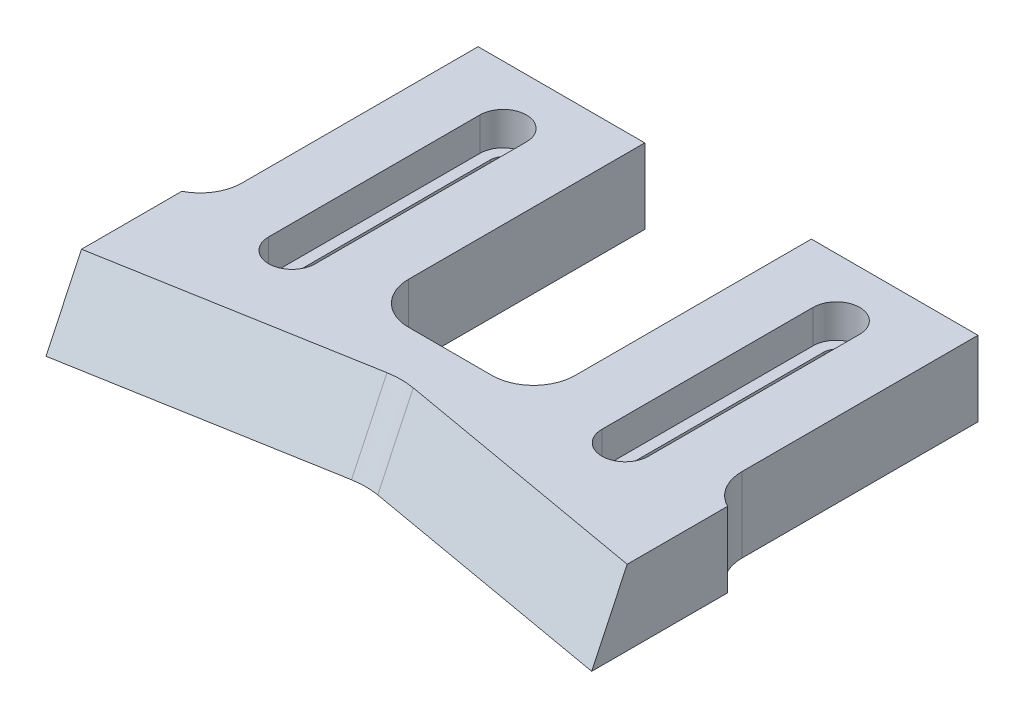
from build123d import *

# Parameters (mm, degrees)
BOSS_EXTRUDE1_DEPTH = 9
CUT_EXTRUDE2_REACH  = 93.001
SKETCH5_W           = 20
SKETCH5_H           = 33.343656478
SKETCH5_W_2         = 7.75
CUT_EXTRUDE3_DEPTH  = 10
FILLET1_R           = 5
CUT_EXTRUDE4_DEPTH  = 4
CHAMFER1_SIZE       = 9
CHAMFER1_SIZE_2     = 4.196768923
FILLET2_R           = 10
CUT_EXTRUDE5_REACH  = 93.001
SKETCH7_W           = 5
SKETCH7_H           = 18.120809616


with BuildPart() as part:
    # Sketch1 → Boss-Extrude1 (new body)
    with BuildSketch(Plane(origin=(0, 0, 0), x_dir=(1, 0, 0), z_dir=(0, 1, 0))):
        Polygon((0, 0), (0, 50), (75.5, 50), (75.5, 0), (37.75, 6.656343522), align=None)
    extrude(amount=BOSS_EXTRUDE1_DEPTH)

    # Sketch4 → Cut-Extrude2 (cut, up to next)
    with BuildSketch(Plane(origin=(0, 9, 0), x_dir=(1, 0, 0), z_dir=(0, 1, 0)), mode=Mode.PRIVATE) as cut_extrude2_sk1:
        with BuildLine():
            Line((19.25, 43), (19.25, 17.656343522))
            ThreePointArc((19.25, 17.656343522), (17.75, 16.156343522), (16.25, 17.656343522))
            Line((16.25, 17.656343522), (16.25, 43))
            ThreePointArc((16.25, 43), (17.75, 44.5), (19.25, 43))
        make_face()
    cut_extrude2_tool1 = extrude(cut_extrude2_sk1.sketch, amount=-CUT_EXTRUDE2_REACH, mode=Mode.PRIVATE) & part.part
    # Sketch4 → Cut-Extrude2 (cut, up to next)
    with BuildSketch(Plane(origin=(0, 9, 0), x_dir=(1, 0, 0), z_dir=(0, 1, 0)), mode=Mode.PRIVATE) as cut_extrude2_sk2:
        with BuildLine():
            Line((59.25, 43), (59.25, 17.656343522))
            ThreePointArc((59.25, 17.656343522), (57.75, 16.156343522), (56.25, 17.656343522))
            Line((56.25, 17.656343522), (56.25, 43))
            ThreePointArc((56.25, 43), (57.75, 44.5), (59.25, 43))
        make_face()
    cut_extrude2_tool2 = extrude(cut_extrude2_sk2.sketch, amount=-CUT_EXTRUDE2_REACH, mode=Mode.PRIVATE) & part.part
    add(cut_extrude2_tool1.solids().sort_by_distance((17.75, 9, -30.328172))[0], mode=Mode.SUBTRACT)
    add(cut_extrude2_tool2.solids().sort_by_distance((57.75, 9, -30.328172))[0], mode=Mode.SUBTRACT)

    # Sketch5 → Cut-Extrude3 (cut)
    with BuildSketch(Plane(origin=(0, 9, 0), x_dir=(1, 0, 0), z_dir=(0, 1, 0))):
        with Locations((37.75, 33.328171761)):
            Rectangle(SKETCH5_W, SKETCH5_H)
        with Locations((71.625, 33.328171761)):
            Rectangle(SKETCH5_W_2, SKETCH5_H)
        with Locations((3.875, 33.328171761)):
            Rectangle(SKETCH5_W_2, SKETCH5_H)
    extrude(amount=-CUT_EXTRUDE3_DEPTH, mode=Mode.SUBTRACT)

    # Fillet1
    fillet1_edges = [part.edges().sort_by_distance(p)[0] for p in [
        (27.75, 4.5, -16.656343522),
        (47.75, 4.5, -16.656343522),
        (7.75, 4.5, -16.656343522),
        (67.75, 4.5, -16.656343522),
    ]]
    fillet(fillet1_edges, radius=FILLET1_R)

    # Sketch6 → Cut-Extrude4 (cut)
    with BuildSketch(Plane(origin=(0, 9, 0), x_dir=(1, 0, 0), z_dir=(0, 1, 0))):
        with BuildLine():
            Line((20.55, 43), (20.55, 17.656343522))
            ThreePointArc((20.55, 17.656343522), (17.75, 14.856343522), (14.95, 17.656343522))
            Line((14.95, 17.656343522), (14.95, 43))
            ThreePointArc((14.95, 43), (17.75, 45.8), (20.55, 43))
        make_face()
        with BuildLine():
            Line((60.55, 43), (60.55, 17.656343522))
            ThreePointArc((60.55, 17.656343522), (57.75, 14.856343522), (54.95, 17.656343522))
            Line((54.95, 17.656343522), (54.95, 43))
            ThreePointArc((54.95, 43), (57.75, 45.8), (60.55, 43))
        make_face()
    extrude(amount=-CUT_EXTRUDE4_DEPTH, mode=Mode.SUBTRACT)

    # Chamfer1
    # the kernel refuses this chamfer: 9, 4.196768923 mm, written as the material it takes off along each edge
    with BuildSketch(Plane(origin=(98.464514589, 9, 4.049263521), x_dir=(-0.0028324039269935573, -0.9998669641130703, 0.01606336089697195), z_dir=(-0.9848077530122074, 0, -0.17364817766693472))) as chamfer1_piece_1_section:
        Polygon((CHAMFER1_SIZE * 0.999866964113, -CHAMFER1_SIZE * 0.0163111641311), (-CHAMFER1_SIZE_2 * 0.0163111641326, -CHAMFER1_SIZE_2 * 0.999866964207), (0, 0), align=None)
    chamfer1_piece_1 = extrude(amount=84.969913084, mode=Mode.PRIVATE)
    chamfer1_piece_1 = split(chamfer1_piece_1, bisect_by=Plane(origin=(68.314499837, 5.890721228, -12.045689495), z_dir=(0.17364817766693472, 0, 0.9848077530122074)), keep=Keep.TOP, mode=Mode.PRIVATE)
    add(chamfer1_piece_1, mode=Mode.SUBTRACT)
    with BuildSketch(Plane(origin=(60.714514589, 9, -10.705607043), x_dir=(0.0028324039269935768, -0.9998669641130703, 0.016063360896972065), z_dir=(-0.9848077530122074, 0, 0.17364817766693472))) as chamfer1_piece_2_section:
        Polygon((CHAMFER1_SIZE * 0.999866964113, -CHAMFER1_SIZE * 0.0163111641311), (-CHAMFER1_SIZE_2 * 0.0163111641326, -CHAMFER1_SIZE_2 * 0.999866964207), (0, 0), align=None)
    chamfer1_piece_2 = extrude(amount=84.969913084, mode=Mode.PRIVATE)
    chamfer1_piece_2 = split(chamfer1_piece_2, bisect_by=Plane(origin=(7.185500163, 5.890721228, -12.045689495), z_dir=(-0.17364817766693472, 0, 0.9848077530122074)), keep=Keep.TOP, mode=Mode.PRIVATE)
    add(chamfer1_piece_2, mode=Mode.SUBTRACT)
    with BuildSketch(Plane(origin=(98.464514589, 9, 4.049263521), x_dir=(-0.0028324039269935573, -0.9998669641130703, 0.01606336089697195), z_dir=(-0.9848077530122074, 0, -0.17364817766693472))) as chamfer1_piece_3a_section:
        Polygon((CHAMFER1_SIZE * 0.999866964113, -CHAMFER1_SIZE * 0.0163111641311), (-CHAMFER1_SIZE_2 * 0.0163111641326, -CHAMFER1_SIZE_2 * 0.999866964207), (0, 0), align=None)
    chamfer1_piece_3a = extrude(amount=84.969913084, mode=Mode.PRIVATE)
    chamfer1_piece_3a = split(chamfer1_piece_3a, bisect_by=Plane(origin=(29.282530451, 6.096120999, -5.163300182), z_dir=(-0.17364817766693472, 0, -0.9848077530122074)), keep=Keep.TOP, mode=Mode.PRIVATE)
    with BuildSketch(Plane(origin=(60.714514589, 9, -10.705607043), x_dir=(0.0028324039269935768, -0.9998669641130703, 0.016063360896972065), z_dir=(-0.9848077530122074, 0, 0.17364817766693472))) as chamfer1_piece_3b_section:
        Polygon((CHAMFER1_SIZE * 0.999866964113, -CHAMFER1_SIZE * 0.0163111641311), (-CHAMFER1_SIZE_2 * 0.0163111641326, -CHAMFER1_SIZE_2 * 0.999866964207), (0, 0), align=None)
    chamfer1_piece_3b = extrude(amount=84.969913084, mode=Mode.PRIVATE)
    chamfer1_piece_3b = split(chamfer1_piece_3b, bisect_by=Plane(origin=(46.217469549, 6.096120999, -5.163300182), z_dir=(0.17364817766693472, 0, -0.9848077530122074)), keep=Keep.TOP, mode=Mode.PRIVATE)
    chamfer1_piece_3 = chamfer1_piece_3a & chamfer1_piece_3b
    add(chamfer1_piece_3, mode=Mode.SUBTRACT)

    # Fillet2
    fillet2_edges = [part.edges().sort_by_distance(p)[0] for p in [
        (37.75, 4.5, -8.787098946),
    ]]
    fillet(fillet2_edges, radius=FILLET2_R)

    # Sketch7 → Cut-Extrude5 (cut, up to next)
    with BuildSketch(Plane(origin=(0, 9, 0), x_dir=(1, 0, 0), z_dir=(0, 1, 0)), mode=Mode.PRIVATE) as cut_extrude5_sk1:
        with Locations((2.5, 9.060404808)):
            Rectangle(SKETCH7_W, SKETCH7_H)
    cut_extrude5_tool1 = extrude(cut_extrude5_sk1.sketch, amount=-CUT_EXTRUDE5_REACH, mode=Mode.PRIVATE) & part.part
    # Sketch7 → Cut-Extrude5 (cut, up to next)
    with BuildSketch(Plane(origin=(0, 9, 0), x_dir=(1, 0, 0), z_dir=(0, 1, 0)), mode=Mode.PRIVATE) as cut_extrude5_sk2:
        with Locations((73, 9.060404808)):
            Rectangle(SKETCH7_W, SKETCH7_H)
    cut_extrude5_tool2 = extrude(cut_extrude5_sk2.sketch, amount=-CUT_EXTRUDE5_REACH, mode=Mode.PRIVATE) & part.part
    add(cut_extrude5_tool1.solids().sort_by_distance((2.5, 9, -9.060405))[0], mode=Mode.SUBTRACT)
    add(cut_extrude5_tool2.solids().sort_by_distance((73, 9, -9.060405))[0], mode=Mode.SUBTRACT)


solid = part.part
